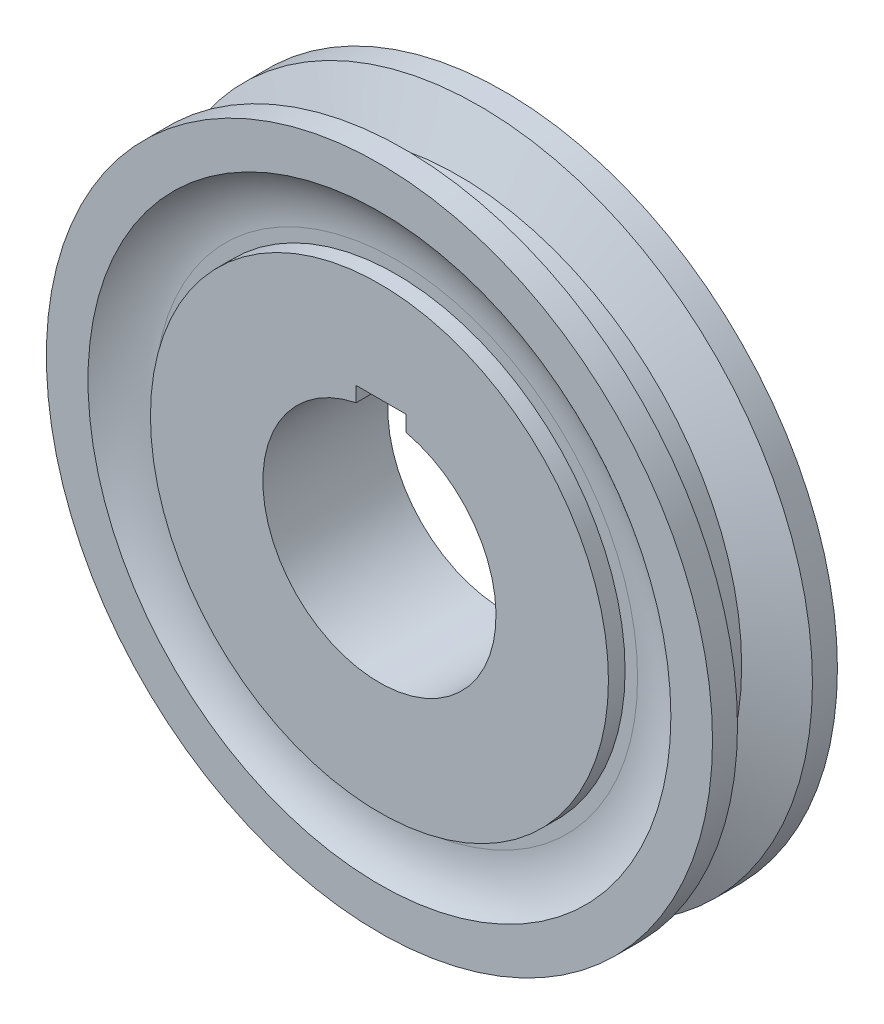
from build123d import *

# Parameters (mm, degrees)
CUT_EXTRUDE1_DEPTH = 59.523499554
SKETCH3_R          = 35
SKETCH3_R_2        = 27.5
CUT_EXTRUDE2_DEPTH = 2
CUT_EXTRUDE3_START = -2
SKETCH4_R          = 35
SKETCH4_R_2        = 27.5
CUT_EXTRUDE3_DEPTH = 2
FILLET1_R          = 10
FILLET2_R          = 10


with BuildPart() as part:
    # Sketch1 → Revolve1 (revolve)
    with BuildSketch(Plane(origin=(0, 0, 0), x_dir=(0, 0, -1), z_dir=(1, 0, 0)), mode=Mode.PRIVATE) as revolve1_sk:
        Polygon((-7.5, 40), (-4.5, 40), (-2, 34), (2, 34), (4.5, 40), (7.5, 40), (7.5, 0), (-7.5, 0), align=None)
    revolve(revolve1_sk.sketch.rotate(Axis((0, 0, 652.003718611), (0, 0, -1)), 90), axis=Axis((0, 0, 652.003718611), (0, 0, -1)))

    # Sketch2 → Cut-Extrude1 (cut, through all)
    with BuildSketch(Plane.XY.offset(7.5)):
        with BuildLine():
            Line((3.2, 15.520204103), (-2.8, 15.520204103))
            Line((-2.8, 15.520204103), (-2.8, 13.71714256))
            ThreePointArc((-2.8, 13.71714256), (-0.204757333, -13.998502578), (3.2, 13.62938003))
            Line((3.2, 13.62938003), (3.2, 15.520204103))
        make_face()
    extrude(amount=-CUT_EXTRUDE1_DEPTH, mode=Mode.SUBTRACT)

    # Sketch3 → Cut-Extrude2 (cut)
    with BuildSketch(Plane.XY.offset(7.5)):
        Circle(SKETCH3_R)
        Circle(SKETCH3_R_2, mode=Mode.SUBTRACT)
    extrude(amount=-CUT_EXTRUDE2_DEPTH, mode=Mode.SUBTRACT)

    # Sketch4 → Cut-Extrude3 (cut)
    with BuildSketch(Plane(origin=(0, 0, -7.5), x_dir=(-1, 0, 0), z_dir=(0, 0, -1)).offset(CUT_EXTRUDE3_START)):
        with Locations(Location((0, 0, 0), (0, 0, 180))):
            Circle(SKETCH4_R)
        with Locations(Location((0, 0, 0), (0, 0, 180))):
            Circle(SKETCH4_R_2, mode=Mode.SUBTRACT)
    extrude(amount=CUT_EXTRUDE3_DEPTH, mode=Mode.SUBTRACT)

    # Fillet1
    # the kernel refuses this fillet: 10 mm, written as the material it adds along each edge
    with BuildSketch(Plane(origin=(0, 0, 5.5), x_dir=(1, 0, 0), z_dir=(0, -1, 0))) as fillet1_piece_1:
        with BuildLine():
            CenterArc((29, 10), FILLET1_R, 270, 36.869897646)
            Line((29, 0), (29, -0.2))
            Line((29, -0.2), (35, -0.2))
            Line((35, -0.2), (35.2, 0))
            ThreePointArc((35.2, 0), (35.2, 1), (35.12, 1.84))
            Line((35.12, 1.84), (35, 2))
        make_face()
    revolve(axis=Axis((0, 0, 5.5), (0, 0, 1)))

    # Fillet2
    # the kernel refuses this fillet: 10 mm, written as the material it adds along each edge
    with BuildSketch(Plane(origin=(0, 0, -5.5), x_dir=(1, 0, 0), z_dir=(0, 1, 0))) as fillet2_piece_1:
        with BuildLine():
            CenterArc((33.5, 10), FILLET2_R, 233.130102354, 36.869897646)
            Line((33.5, 0), (33.5, -0.2))
            Line((33.5, -0.2), (27.5, -0.2))
            Line((27.5, -0.2), (27.3, 0))
            ThreePointArc((27.3, 0), (27.3, 1), (27.38, 1.84))
            Line((27.38, 1.84), (27.5, 2))
        make_face()
    revolve(axis=Axis((0, 0, -5.5), (0, 0, -1)))


solid = part.part
